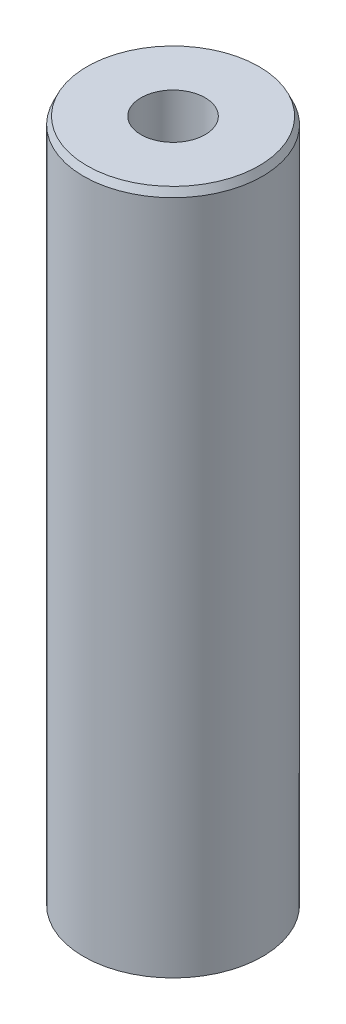
from build123d import *
from OCP.BRepFilletAPI import BRepFilletAPI_MakeChamfer

# Parameters (mm, degrees)
SKETCH1_R           = 57.5
BOSS_EXTRUDE1_DEPTH = 441.389600119
SKETCH2_R           = 20.615555958
CUT_EXTRUDE1_DEPTH  = 449.817645702
CHAMFER1_SIZE       = 4.74203371
CHAMFER1_SIZE2      = 2.212650476


with BuildPart() as part:
    # Sketch1 → Boss-Extrude1 (new body)
    with BuildSketch(Plane(origin=(0, 0, 0), x_dir=(1, 0, 0), z_dir=(0, 1, 0))):
        Circle(SKETCH1_R)
    extrude(amount=BOSS_EXTRUDE1_DEPTH)

    # Sketch2 → Cut-Extrude1 (cut, through all)
    with BuildSketch(Plane(origin=(0, 0, 0), x_dir=(1, 0, 0), z_dir=(0, 1, 0))):
        Circle(SKETCH2_R)
    extrude(amount=CUT_EXTRUDE1_DEPTH, mode=Mode.SUBTRACT)

    # Chamfer1: one chamfer whose edges measure the first distance from different faces: ONE call of the kernel's chamfer builder (chamfer() names one face for all edges)
    chamfer1_edges_1 = [part.edges().sort_by_distance(p)[0] for p in [
        (-57.5, 441.389600119, 0),
    ]]
    chamfer1_side_1 = [part.faces().sort_by_distance(p)[0] for p in [
        (-57.5, 220.69480006, 0),
    ]]
    chamfer1_edges_2 = [part.edges().sort_by_distance(p)[0] for p in [
        (-57.5, 0, 0),
    ]]
    chamfer1_side_2 = [part.faces().sort_by_distance(p)[0] for p in [
        (-55.873654403, 0, 0),
    ]]
    chamfer1 = BRepFilletAPI_MakeChamfer(part.part.solid().wrapped)
    for e in chamfer1_edges_1:
        chamfer1.Add(CHAMFER1_SIZE, CHAMFER1_SIZE2, e.wrapped, chamfer1_side_1[0].wrapped)  # the first distance lies on this face
    for e in chamfer1_edges_2:
        chamfer1.Add(CHAMFER1_SIZE, CHAMFER1_SIZE2, e.wrapped, chamfer1_side_2[0].wrapped)  # the first distance lies on this face
    add(Compound.cast(chamfer1.Shape()), mode=Mode.REPLACE)


solid = part.part
